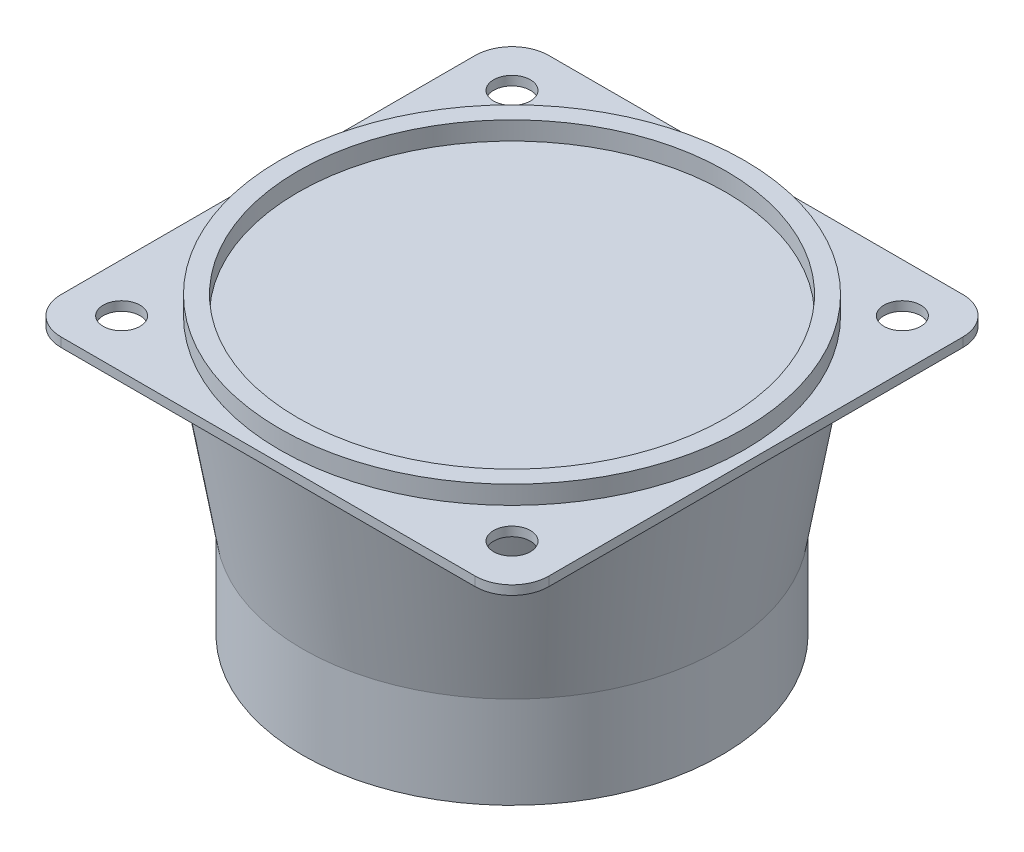
from build123d import *

# Parameters (mm, degrees)
SKETCH_1_R          = 25.25
SKETCH_1_R_2        = 23.25
EXTRUDE_1_DEPTH     = 2
SKETCH_2_W          = 53
SKETCH_2_H          = 53
EXTRUDE_1_2_DEPTH   = 1
FILLET_1_R          = 4
SKETCH_3_R          = 22.75
EXTRUDE_2_DEPTH     = 10
SKETCH_5_R          = 2
CUT_EXTRUDE_1_DEPTH = 10


# Read off the part's stored shape, not the designer's step: 放样3
with BuildPart() as part:
    # 草图1 → Extrude 1 (new body)
    with BuildSketch(Plane(origin=(0, 0, 0), x_dir=(1, 0, 0), z_dir=(0, 1, 0))):
        Circle(SKETCH_1_R)
        Circle(SKETCH_1_R_2, mode=Mode.SUBTRACT)
    extrude(amount=EXTRUDE_1_DEPTH)

    # 草图2 → Extrude 1 2 (add)
    with BuildSketch(Plane.XZ):
        Rectangle(SKETCH_2_W, SKETCH_2_H)
    extrude(amount=EXTRUDE_1_2_DEPTH)

    # 圆角1
    fillet_1_edges = [part.edges().sort_by_distance(p)[0] for p in [
        (26.5, -0.5, 26.5),
        (-26.5, -0.5, 26.5),
        (-26.5, -0.5, -26.5),
        (26.5, -0.5, -26.5),
    ]]
    fillet(fillet_1_edges, radius=FILLET_1_R)



with BuildPart() as body_2:
    # 草图3 → 凸台-拉伸2 (new body)
    with BuildSketch(Plane(origin=(0, -30, 0), x_dir=(1, 0, 0), z_dir=(0, 1, 0))):
        with Locations(Location((0, 0, 0), (0, 0, 270))):
            Circle(SKETCH_3_R)
    extrude(amount=EXTRUDE_2_DEPTH)


with BuildPart() as part_1:
    add(part.part)

    add(body_2.part)  # 放样3 merges body 2
    # 放样3 outline → 放样3 (revolve)
    with BuildSketch(Plane.XY):
        Polygon((0, -20), (22.75, -20), (26, -1), (0, -1), align=None)
    revolve(axis=Axis((0, 0, 0), (0, 1, 0)))

    # 草图5 → 切除-拉伸1 (cut)
    with BuildSketch(Plane(origin=(0, 0, 0), x_dir=(1, 0, 0), z_dir=(0, 1, 0))):
        with Locations(Location((-21.213203436, 21.213203436, 0), (0, 0, 270))):
            Circle(SKETCH_5_R)
        with Locations(Location((-21.213203436, -21.213203436, 0), (0, 0, 270))):
            Circle(SKETCH_5_R)
        with Locations(Location((21.213203436, -21.213203436, 0), (0, 0, 270))):
            Circle(SKETCH_5_R)
        with Locations(Location((21.213203436, 21.213203436, 0), (0, 0, 270))):
            Circle(SKETCH_5_R)
    extrude(amount=-CUT_EXTRUDE_1_DEPTH, mode=Mode.SUBTRACT)


solid = part_1.part
